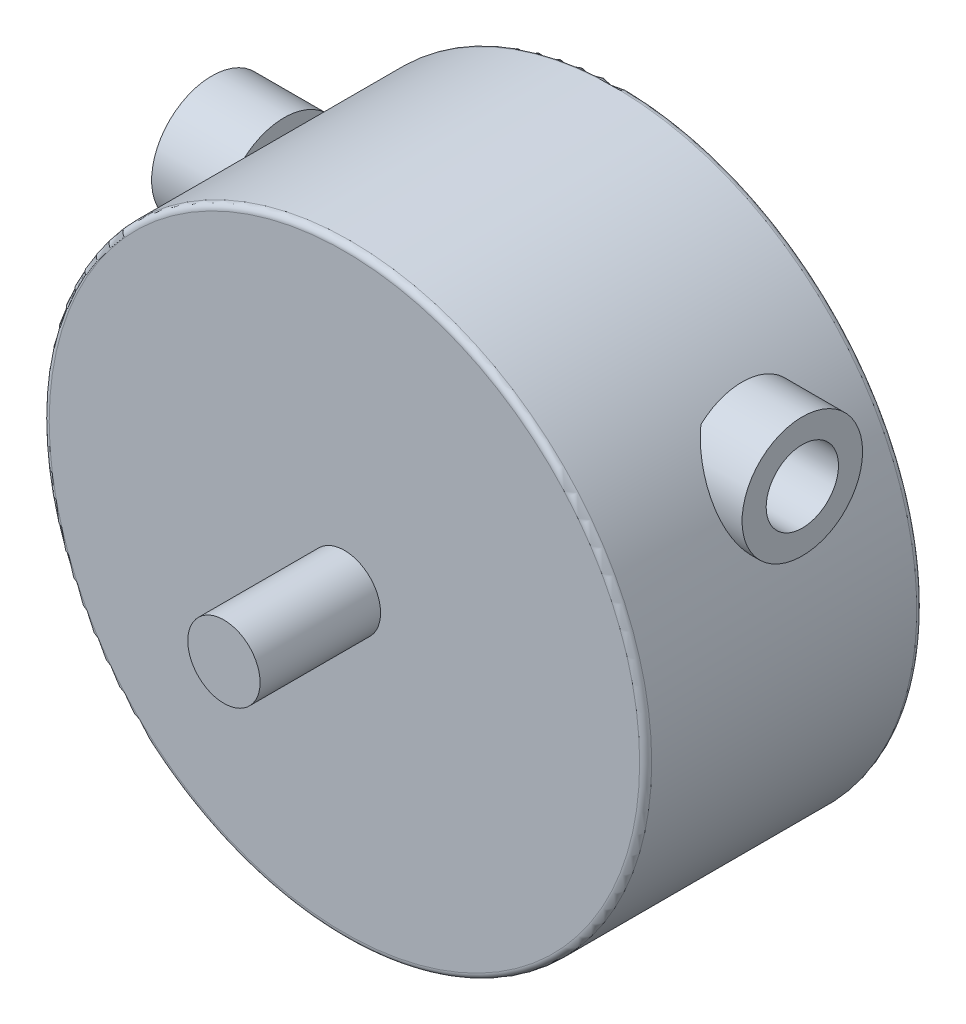
from build123d import *
from build123d.topology import SkipClean

# Parameters (mm, degrees)
SKETCH_1_R               = 25
EXTRUDE_1_DEPTH          = 8
SKETCH_2_R               = 3
EXTRUDE_2_DEPTH          = 10
EXTRUDE_START            = 10
SKETCH_3_R               = 25
SKETCH_3_R_2             = 20
EXTRUDE_3_DEPTH          = 10
SKETCH_4_R               = 5
EXTRUDE_4_DEPTH          = 2
SKETCH_5_R               = 2.5
EXTRUDE_5_DEPTH          = 8
EXTRUDE_START_2          = 5
SKETCH_6_R               = 25
SKETCH_6_R_2             = 5
EXTRUDE_6_DEPTH          = 5
CUT_EXTRUDE_1_DEPTH      = 40.67366885
CUT_EXTRUDE_1_DEPTH_BACK = 40.67366885
SKETCH_8_R               = 3
SKETCH_9_R               = 5
SKETCH_9_R_2             = 3
EXTRUDE_7_DEPTH          = 6
SKETCH_10_R              = 5
EXTRUDE_8_DEPTH          = 5
SKETCH_11_R              = 3
CUT_EXTRUDE_2_DEPTH      = 5
FILLET_1_R               = 0.5


with BuildPart() as part:
    # 草图1 → 凸台-拉伸1 (new body)
    with BuildSketch(Plane.XY):
        Circle(SKETCH_1_R)
    extrude(amount=EXTRUDE_1_DEPTH)

    # 草图2 → 凸台-拉伸2 (add)
    with BuildSketch(Plane.XY.offset(8)):
        Circle(SKETCH_2_R)
    extrude(amount=EXTRUDE_2_DEPTH)

    # 草图3 → 凸台-拉伸3 (add)
    with BuildSketch(Plane(origin=(0, 0, 0), x_dir=(-1, 0, 0), z_dir=(0, 0, -1)).offset(EXTRUDE_START)):
        Circle(SKETCH_3_R)
        Circle(SKETCH_3_R_2, mode=Mode.SUBTRACT)
    extrude(amount=-EXTRUDE_3_DEPTH)

    # 草图4 → 凸台-拉伸4 (add)
    with BuildSketch(Plane(origin=(0, 0, 0), x_dir=(-1, 0, 0), z_dir=(0, 0, -1))):
        with Locations(Location((0, 0, 0), (0, 0, 180))):
            Circle(SKETCH_4_R)
    extrude(amount=EXTRUDE_4_DEPTH)

    # 草图5 → 凸台-拉伸5 (add)
    with BuildSketch(Plane(origin=(0, 0, -2), x_dir=(-1, 0, 0), z_dir=(0, 0, -1))):
        Circle(SKETCH_5_R)
    extrude(amount=EXTRUDE_5_DEPTH)

    # 草图6 → 凸台-拉伸6 (add)
    with BuildSketch(Plane(origin=(0, 0, -10), x_dir=(-1, 0, 0), z_dir=(0, 0, -1)).offset(EXTRUDE_START_2)):
        Circle(SKETCH_6_R)
        with Locations(Location((0, 0, 0), (0, 0, 180))):
            Circle(SKETCH_6_R_2, mode=Mode.SUBTRACT)
    extrude(amount=-EXTRUDE_6_DEPTH)

    # 草图8 → 切除-拉伸1 (cut, two sides: drawn at the far end of the back side and taken through both)
    with BuildSketch(Plane(origin=(0, 0, 0), x_dir=(0, 0, -1), z_dir=(1, 0, 0)).offset(-CUT_EXTRUDE_1_DEPTH_BACK)):
        with Locations(Location((6, 12.6, 0), (0, 0, 180))):
            Circle(SKETCH_8_R)
    extrude(amount=CUT_EXTRUDE_1_DEPTH + CUT_EXTRUDE_1_DEPTH_BACK, mode=Mode.SUBTRACT)

    # 草图9 → 凸台-拉伸7 (add, through all)
    with SkipClean():  # the faces are left unmerged after this step: merging them gives an invalid solid
        with BuildSketch(Plane(origin=(-19, 0, 0), x_dir=(0, 0, -1), z_dir=(1, 0, 0))):
            with Locations((6, 12.6)):
                Circle(SKETCH_9_R)
            with Locations(Location((6, 12.6, 0), (0, 0, 180))):
                Circle(SKETCH_9_R_2, mode=Mode.SUBTRACT)
        extrude(amount=-EXTRUDE_7_DEPTH)

    # 草图10 → 凸台-拉伸8 (add)
    with BuildSketch(Plane(origin=(19, 0, 0), x_dir=(0, 0, -1), z_dir=(1, 0, 0)).offset(EXTRUDE_START_2)):
        with Locations((6, 12.6)):
            Circle(SKETCH_10_R)
    extrude(amount=-EXTRUDE_8_DEPTH)

    # 草图11 → 切除-拉伸2 (cut)
    with BuildSketch(Plane(origin=(24, 0, 0), x_dir=(0, 0, -1), z_dir=(1, 0, 0))):
        with Locations(Location((6, 12.6, 0), (0, 0, 180))):
            Circle(SKETCH_11_R)
    extrude(amount=-CUT_EXTRUDE_2_DEPTH, mode=Mode.SUBTRACT)

    # 圆角1
    fillet_1_edges = [part.edges().sort_by_distance(p)[0] for p in [
        (25, 0, -15),
        (-25, 0, 8),
    ]]
    fillet(fillet_1_edges, radius=FILLET_1_R)


solid = part.part
